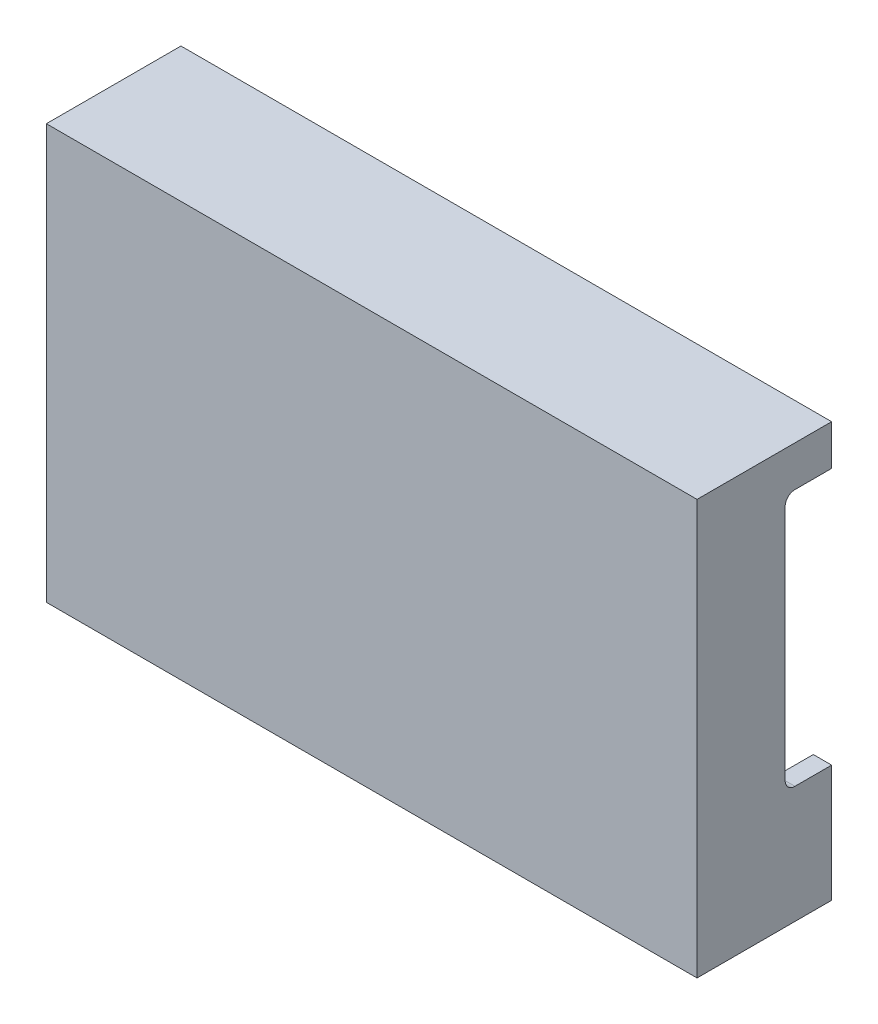
from build123d import *

# Parameters (mm, degrees)
SKETCH_1_W          = 48.184
SKETCH_1_H          = 28.88
SKETCH_1_W_2        = 1
SKETCH_1_H_2        = 23.68
EXTRUDE_1_DEPTH     = 2
EXTRUDE_2_DEPTH     = 11.4
SKETCH_1_7_W        = 53.184
SKETCH_1_7_H        = 33.88
SKETCH_1_7_W_2      = 50.184
SKETCH_1_7_H_2      = 30.88
EXTRUDE_3_DEPTH     = 11
SKETCH_2_W          = 3.8
SKETCH_2_H          = 21
CUT_EXTRUDE_1_DEPTH = 62.941490586
SKETCH_3_W          = 5
SKETCH_3_H          = 10
SKETCH_3_W_2        = 9
SKETCH_3_H_2        = 13
CUT_EXTRUDE_2_DEPTH = 62.109575813
FILLET_1_R          = 0.8
CHAMFER_1_SIZE      = 0.4
SKETCH_4_R          = 2
CUT_EXTRUDE_3_DEPTH = 1.2
SKETCH_4_3_W        = 2
SKETCH_4_3_H        = 8
EXTRUDE_4_DEPTH     = 8


with BuildPart() as part:
    # Эскиз1 → Бобышка-Вытянуть1 (new body)
    with BuildSketch(Plane.XY):
        with Locations((24.892, 15.24)):
            Rectangle(SKETCH_1_W, SKETCH_1_H)
        with Locations((49.484, 17.84)):
            Rectangle(SKETCH_1_W_2, SKETCH_1_H_2)
    extrude(amount=-EXTRUDE_1_DEPTH)

    # Эскиз1<6> → Бобышка-Вытянуть2 (add)
    with BuildSketch(Plane.XY):
        Polygon((0.8, 29.68), (48.984, 29.68), (49.984, 29.68), (49.984, 30.68), (-0.2, 30.68), (-0.2, -0.2), (49.984, -0.2), (49.984, 6), (48.984, 6), (48.984, 0.8), (0.8, 0.8), align=None)
    extrude(amount=-EXTRUDE_2_DEPTH)

    # Эскиз1<7> → Бобышка-Вытянуть3 (add)
    with BuildSketch(Plane.XY):
        with Locations((24.892, 15.24)):
            Rectangle(SKETCH_1_7_W, SKETCH_1_7_H)
        with Locations((24.892, 15.24)):
            Rectangle(SKETCH_1_7_W_2, SKETCH_1_7_H_2, mode=Mode.SUBTRACT)
    extrude(amount=-EXTRUDE_3_DEPTH)

    # Эскиз2 → Вырез-Вытянуть1 (cut, through all)
    with BuildSketch(Plane.ZY.offset(-49.984)):
        with Locations((-9.1, 18.37)):
            Rectangle(SKETCH_2_W, SKETCH_2_H)
    extrude(amount=-CUT_EXTRUDE_1_DEPTH, mode=Mode.SUBTRACT)

    # Эскиз3 → Вырез-Вытянуть2 (cut, through all)
    with BuildSketch(Plane(origin=(0.8, 0, 0), x_dir=(0, 0, -1), z_dir=(1, 0, 0))):
        with Locations((8.9, 24.5)):
            Rectangle(SKETCH_3_W, SKETCH_3_H)
        with Locations((6.9, 8.25)):
            Rectangle(SKETCH_3_W_2, SKETCH_3_H_2)
    extrude(amount=-CUT_EXTRUDE_2_DEPTH, mode=Mode.SUBTRACT)

    # Скругление1
    fillet_1_edges = [part.edges().sort_by_distance(p)[0] for p in [
        (-0.45, 29.5, -6.4),
        (-0.45, 19.5, -6.4),
        (-0.45, 14.75, -2.4),
        (-0.45, 1.75, -2.4),
        (50.734, 28.87, -7.2),
        (50.734, 7.87, -7.2),
    ]]
    fillet(fillet_1_edges, radius=FILLET_1_R)

    # Фаска1
    chamfer_1_edges = [part.edges().sort_by_distance(p)[0] for p in [
        (-0.2, 0.775, -11.4),
        (24.892, -0.2, -11.4),
        (49.984, 2.9, -11.4),
        (49.984, 30.18, -11.4),
        (24.892, 30.68, -11.4),
        (-0.2, 30.09, -11.4),
        (-0.2, 17.125, -11.4),
    ]]
    chamfer(chamfer_1_edges, length=CHAMFER_1_SIZE - 0.0001)  # a hair under: the kernel refuses the full size

    # Эскиз4 → Вырез-Вытянуть3 (cut)
    with BuildSketch(Plane(origin=(0, 0, -2), x_dir=(-1, 0, 0), z_dir=(0, 0, -1))):
        with Locations((-40.9, 27.6)):
            Circle(SKETCH_4_R)
        with Locations((-27.6, 27.6)):
            Circle(SKETCH_4_R)
        with Locations((-11.8, 2.8)):
            Circle(SKETCH_4_R)
    extrude(amount=-CUT_EXTRUDE_3_DEPTH, mode=Mode.SUBTRACT)

    # Эскиз4<3> → Бобышка-Вытянуть4 (add)
    with BuildSketch(Plane(origin=(0, 0, -2), x_dir=(-1, 0, 0), z_dir=(0, 0, -1))):
        with Locations((-34.3, 25.68)):
            Rectangle(SKETCH_4_3_W, SKETCH_4_3_H)
    extrude(amount=EXTRUDE_4_DEPTH)


solid = part.part
